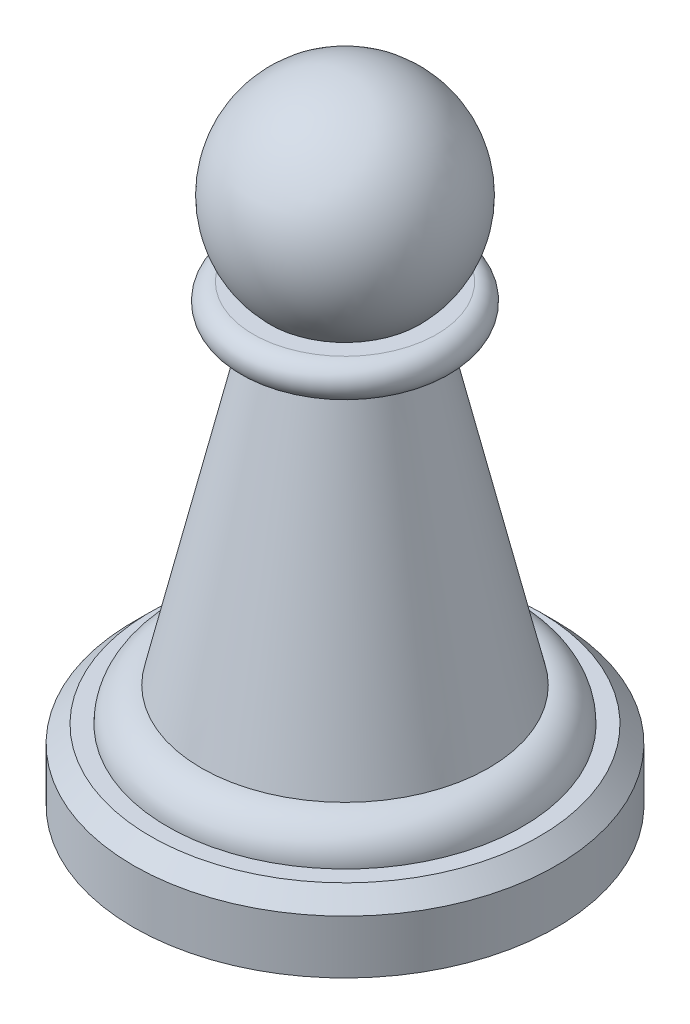
from build123d import *

# Parameters (mm, degrees)
FILLET1_R     = 1.524
CHAMFER1_SIZE = 0.762


with BuildPart() as part:
    # Sketch1 → Revolve1 (revolve)
    with BuildSketch(Plane.XY, mode=Mode.PRIVATE) as revolve1_sk:
        with BuildLine():
            Line((0, 0), (-9.525, 0))
            Line((-9.525, 0), (-9.525, 3.175))
            Line((-9.525, 3.175), (-8.001, 3.175))
            Line((-8.001, 3.175), (-8.001, 4.699))
            Line((-8.001, 4.699), (-6.477, 4.699))
            Line((-6.477, 4.699), (-3.175, 18.923))
            Line((-3.175, 18.923), (-4.131690787, 18.923))
            ThreePointArc((-4.131690787, 18.923), (-4.893690787, 19.685), (-4.131690787, 20.447))
            Line((-4.131690787, 20.447), (-3.369690787, 20.447))
            ThreePointArc((-3.369690787, 20.447), (-4.399409051, 25.63639864), (0, 28.575))
            Line((0, 28.575), (0, 0))
        make_face()
    revolve(revolve1_sk.sketch.rotate(Axis((0, 0, 0), (0, 1, 0)), 270), axis=Axis((0, 0, 0), (0, 1, 0)))

    # Fillet1
    fillet1_edges = [part.edges().sort_by_distance(p)[0] for p in [
        (0, 4.699, 8.001),
    ]]
    fillet(fillet1_edges, radius=FILLET1_R - 0.0001)  # a hair under: the kernel refuses the full size

    # Chamfer1
    chamfer1_edges = [part.edges().sort_by_distance(p)[0] for p in [
        (0, 3.175, 9.525),
    ]]
    chamfer(chamfer1_edges, length=CHAMFER1_SIZE)


solid = part.part
